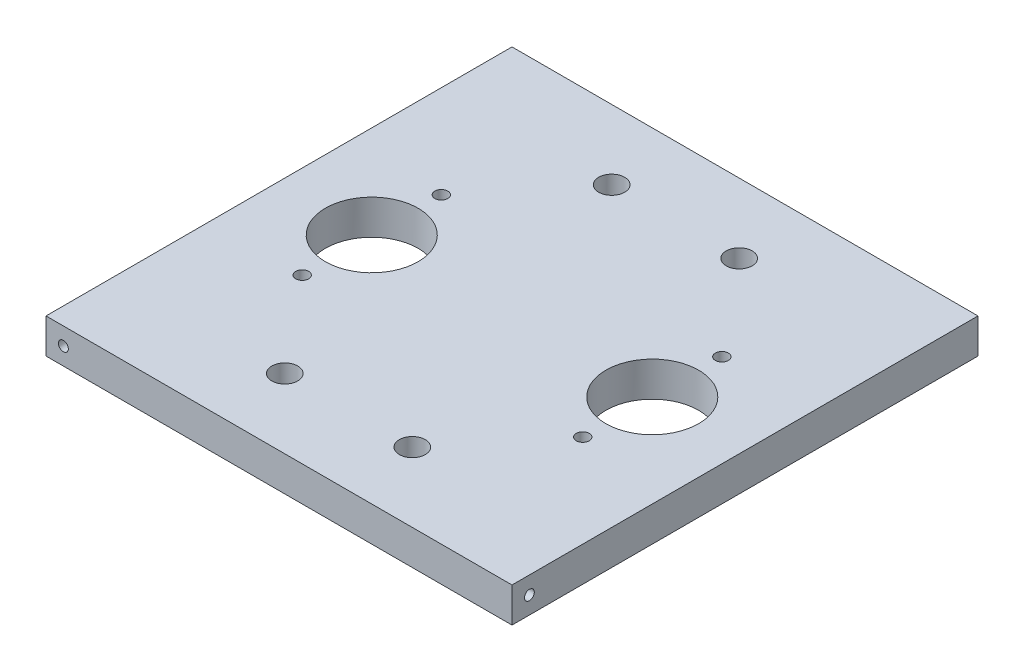
from build123d import *

# Parameters (mm, degrees)
SKETCH1_W                      = 127.635
SKETCH1_H                      = 127.635
MAIN_PLATE_DEPTH               = 9.525
SKETCH2_R                      = 3.556
U_BOLT_HOLE_DEPTH              = 12.7
U_BOLT_PATTERN_COUNT           = 2
U_BOLT_PATTERN_PITCH           = 34.925
U_BOLT_PATTERN_COUNT_DIR2      = 2
U_BOLT_PATTERN_PITCH_DIR2      = 89.535
SKETCH3_R                      = 1.778
RAPTOR_BOLT_HOLE_DEPTH         = 12.7
RAPTOR_BOLT_PATTERN_COUNT      = 2
RAPTOR_BOLT_PATTERN_PITCH      = 38.1
RAPTOR_BOLT_PATTERN_COUNT_DIR2 = 2
RAPTOR_BOLT_PATTERN_PITCH_DIR2 = 76.835
SKETCH4_R                      = 12.7
CO2_CYLINDER_HOLE_DEPTH        = 12.7
CO2_PATTERN_COUNT              = 2
CO2_PATTERN_PITCH              = 76.835
SKETCH5_R                      = 1.35255
FRAME_ATTACHMENT_HOLE_1_DEPTH  = 12.7
SKETCH6_R                      = 1.35255
FRAME_ATTACHMENT_HOLE_2_DEPTH  = 12.7
SKETCH7_R                      = 1.35255
FRAME_ATTACHMENT_HOLE_3_DEPTH  = 12.7
SKETCH8_R                      = 1.35255
FRAME_ATTACHMENT_HOLE_4_DEPTH  = 12.7


with BuildPart() as part:
    # Sketch1 → Main Plate (new body)
    with BuildSketch(Plane(origin=(0, 0, 0), x_dir=(1, 0, 0), z_dir=(0, 1, 0))):
        with Locations((63.8175, 63.8175)):
            Rectangle(SKETCH1_W, SKETCH1_H)
    extrude(amount=MAIN_PLATE_DEPTH)

    # Sketch2 → U-Bolt Hole (cut)
    with BuildSketch(Plane(origin=(0, 9.525, 0), x_dir=(1, 0, 0), z_dir=(0, 1, 0))):
        with Locations((46.355, 108.585)):
            Circle(SKETCH2_R)
    u_bolt_hole = extrude(amount=-U_BOLT_HOLE_DEPTH, mode=Mode.SUBTRACT)

    # U-Bolt Pattern: U-Bolt Hole 2 × 2
    with Locations(*[(i * U_BOLT_PATTERN_PITCH, 0, j * U_BOLT_PATTERN_PITCH_DIR2) for i in range(U_BOLT_PATTERN_COUNT) for j in range(U_BOLT_PATTERN_COUNT_DIR2) if (i, j) != (0, 0)]):
        add(u_bolt_hole, mode=Mode.SUBTRACT)

    # Sketch3 → Raptor Bolt Hole (cut)
    with BuildSketch(Plane(origin=(0, 9.525, 0), x_dir=(1, 0, 0), z_dir=(0, 1, 0))):
        with Locations((25.4, 44.7675)):
            Circle(SKETCH3_R)
    raptor_bolt_hole = extrude(amount=-RAPTOR_BOLT_HOLE_DEPTH, mode=Mode.SUBTRACT)

    # Raptor Bolt Pattern: Raptor Bolt Hole 2 × 2
    with Locations(*[(j * RAPTOR_BOLT_PATTERN_PITCH_DIR2, 0, -i * RAPTOR_BOLT_PATTERN_PITCH) for i in range(RAPTOR_BOLT_PATTERN_COUNT) for j in range(RAPTOR_BOLT_PATTERN_COUNT_DIR2) if (i, j) != (0, 0)]):
        add(raptor_bolt_hole, mode=Mode.SUBTRACT)

    # Sketch4 → Co2 Cylinder Hole (cut)
    with BuildSketch(Plane(origin=(0, 9.525, 0), x_dir=(1, 0, 0), z_dir=(0, 1, 0))):
        with Locations((25.4, 63.8175)):
            Circle(SKETCH4_R)
    co2_cylinder_hole = extrude(amount=-CO2_CYLINDER_HOLE_DEPTH, mode=Mode.SUBTRACT)

    # Co2 Pattern: Co2 Cylinder Hole ×2
    with Locations(*[(i * CO2_PATTERN_PITCH, 0, 0) for i in range(1, CO2_PATTERN_COUNT)]):
        add(co2_cylinder_hole, mode=Mode.SUBTRACT)

    # Sketch5 → Frame attachment hole 1 (cut)
    with BuildSketch(Plane.XY):
        with Locations((4.7625, 4.7625)):
            Circle(SKETCH5_R)
    extrude(amount=-FRAME_ATTACHMENT_HOLE_1_DEPTH, mode=Mode.SUBTRACT)

    # Sketch6 → Frame attachment hole 2 (cut)
    with BuildSketch(Plane.ZY):
        with Locations((-122.8725, 4.7625)):
            Circle(SKETCH6_R)
    extrude(amount=-FRAME_ATTACHMENT_HOLE_2_DEPTH, mode=Mode.SUBTRACT)

    # Sketch7 → Frame attachment hole 3 (cut)
    with BuildSketch(Plane(origin=(0, 0, -127.635), x_dir=(-1, 0, 0), z_dir=(0, 0, -1))):
        with Locations((-122.8725, 4.7625)):
            Circle(SKETCH7_R)
    extrude(amount=-FRAME_ATTACHMENT_HOLE_3_DEPTH, mode=Mode.SUBTRACT)

    # Sketch8 → Frame attachment hole 4 (cut)
    with BuildSketch(Plane(origin=(127.635, 0, 0), x_dir=(0, 0, -1), z_dir=(1, 0, 0))):
        with Locations((4.7625, 4.7625)):
            Circle(SKETCH8_R)
    extrude(amount=-FRAME_ATTACHMENT_HOLE_4_DEPTH, mode=Mode.SUBTRACT)


solid = part.part
